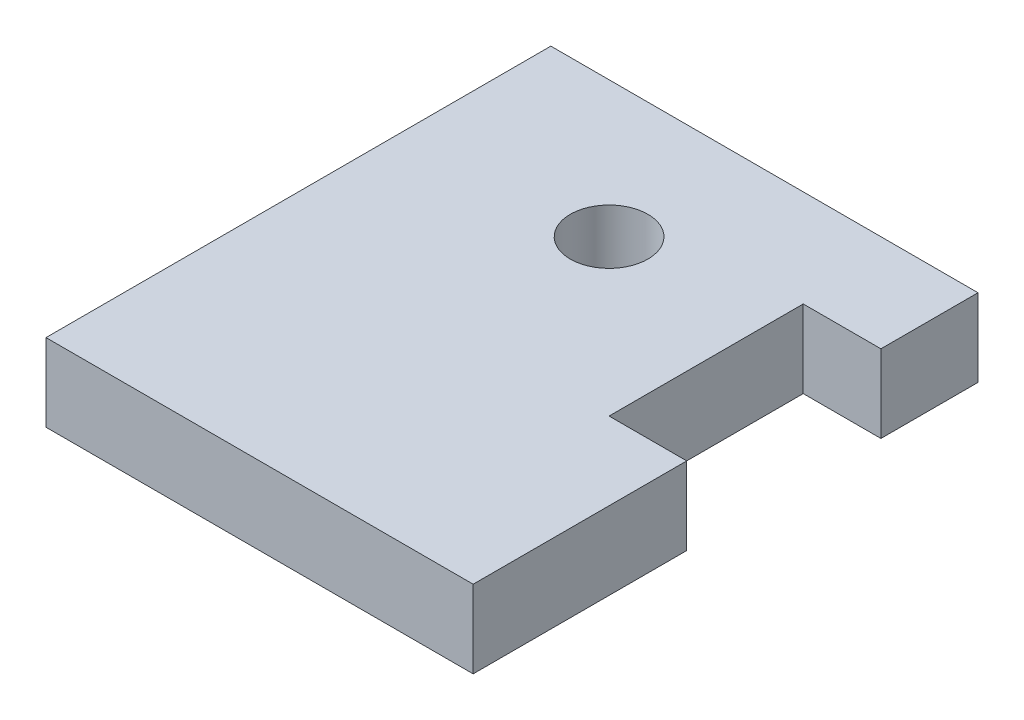
from build123d import *

# Parameters (mm, degrees)
SKETCH1_R           = 2
BOSS_EXTRUDE1_DEPTH = 4


with BuildPart() as part:
    # Sketch1 → Boss-Extrude1 (new body)
    with BuildSketch(Plane(origin=(0, 0, 0), x_dir=(1, 0, 0), z_dir=(0, 1, 0))):
        Polygon((0, 0), (22, 0), (22, 11), (18, 11), (18, 21), (22, 21), (22, 26), (0, 26), align=None)
        with Locations((10, 19)):
            Circle(SKETCH1_R, mode=Mode.SUBTRACT)
    extrude(amount=BOSS_EXTRUDE1_DEPTH)


solid = part.part
